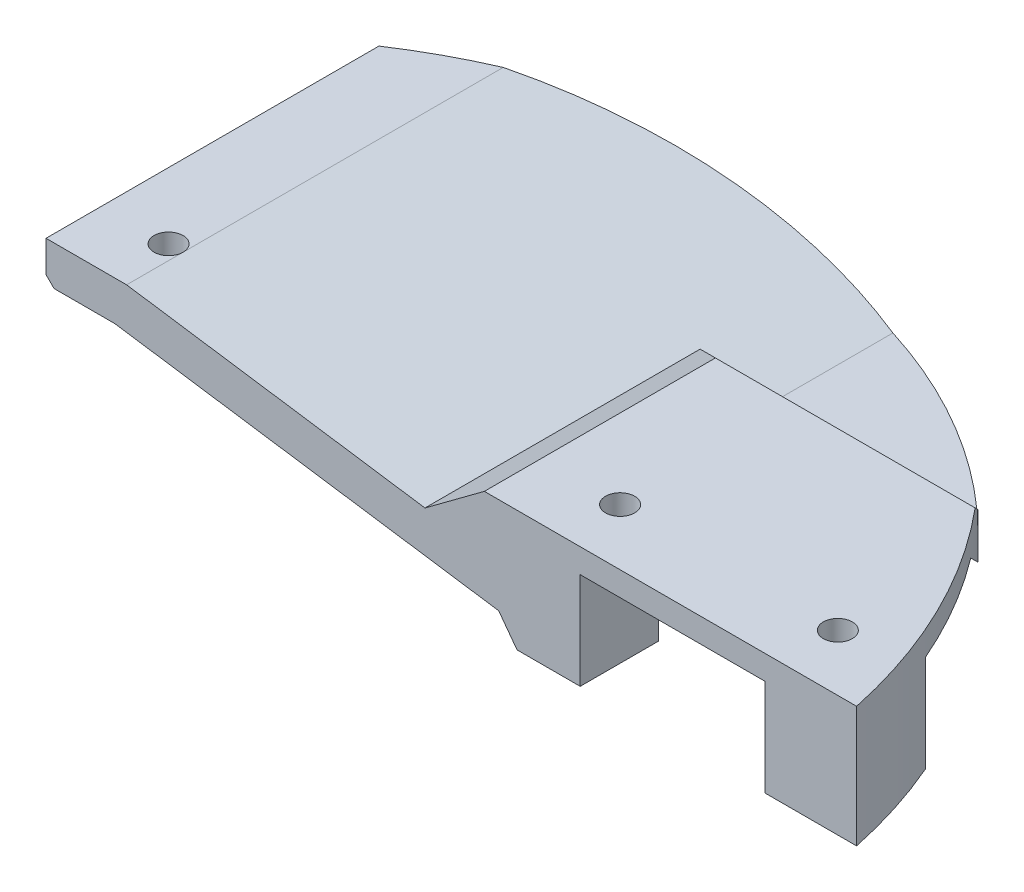
from build123d import *
from build123d.topology import SkipClean

# Parameters (mm, degrees)
SKETCH1_W            = 10
SKETCH1_H            = 10
BOSS_EXTRUDE1_DEPTH  = 4.9
CHAMFER1_SIZE        = 1
BOSS_EXTRUDE2_DEPTH  = 16
BOSS_EXTRUDE3_DEPTH  = 10
BOSS_EXTRUDE4_DEPTH  = 13
CHAMFER2_SIZE        = 12
BOSS_EXTRUDE5_DEPTH  = 30
CUT_EXTRUDE2_REACH   = 128.798
CUT_EXTRUDE1_START   = -15
CUT_EXTRUDE1_DEPTH   = 15
M3_CLEARANCE_HOLE1_D = 3.6
SKETCH11_W           = 1.8
SKETCH11_H           = 4.9
CHAMFER3_SIZE        = 9
CHAMFER3_SIZE_2      = 7.926193673
SKETCH14_R           = 1.8
BOSS_EXTRUDE6_DEPTH  = 12
M3_CLEARANCE_HOLE3_D = 3.6
SKETCH19_W           = 25
SKETCH19_H           = 20
CUT_EXTRUDE3_DEPTH   = 3.062116


# Read off the part's stored shape, not the designer's step: Cut-Extrude1
# Some blends are built 0.0001 mm under size
with BuildPart() as part:
    # Sketch1 → Boss-Extrude1 (new body)
    with BuildSketch(Plane(origin=(0, 0, 0), x_dir=(1, 0, 0), z_dir=(0, 1, 0))):
        with Locations((-5, 5)):
            Rectangle(SKETCH1_W, SKETCH1_H)
    extrude(amount=BOSS_EXTRUDE1_DEPTH)

    # Chamfer1
    chamfer1_edges = [part.edges().sort_by_distance(p)[0] for p in [
        (-10, 0, -5),
    ]]
    chamfer(chamfer1_edges, length=CHAMFER1_SIZE)

    # Sketch2 → Boss-Extrude2 (add)
    with BuildSketch(Plane(origin=(0, 0, -10), x_dir=(-1, 0, 0), z_dir=(0, 0, -1))):
        Polygon((-49.9, -10.1), (-48.419662682, -10.1), (-46.146212445, -7.037883957), (1.467233005, 0), (9, 0), (10, 1), (10, 4.9), (0, 4.9), (-45.9, -1.884614526), (-45.9, 4.9), (-95.9, 4.9), (-95.9, 1.9), (-49.9, 1.9), align=None)
    extrude(amount=BOSS_EXTRUDE2_DEPTH)

    # Sketch2<4> → Boss-Extrude3 (add)
    with BuildSketch(Plane(origin=(0, 0, -10), x_dir=(-1, 0, 0), z_dir=(0, 0, -1))):
        Polygon((-49.9, -10.1), (-48.419662682, -10.1), (-46.146212445, -7.037883957), (1.467233005, 0), (0, 0), (0, 4.9), (-45.9, -1.884614526), (-45.9, 4.9), (-95.9, 4.9), (-95.9, 1.9), (-49.9, 1.9), align=None)
    extrude(amount=-BOSS_EXTRUDE3_DEPTH)

    # Sketch3 → Boss-Extrude4 (add)
    with BuildSketch(Plane(origin=(0, 0, -26), x_dir=(-1, 0, 0), z_dir=(0, 0, -1))):
        Polygon((-95.9, 1.9), (-95.9, -10.1), (-49.9, -10.1), (-48.419662682, -10.1), (-46.146212445, -7.037883957), (1.467233005, 0), (9, 0), (10, 1), (10, 4.9), (0, 4.9), (-45.9, -1.884614526), (-45.9, 4.9), (-95.9, 4.9), align=None)
    extrude(amount=BOSS_EXTRUDE4_DEPTH)

    # Chamfer2
    chamfer2_edges = [part.edges().sort_by_distance(p)[0] for p in [
        (72.9, -10.1, -26),
    ]]
    chamfer(chamfer2_edges, length=CHAMFER2_SIZE - 0.0001)  # a hair under: the kernel refuses the full size

    # Sketch4 → Boss-Extrude5 (add)
    with BuildSketch(Plane(origin=(0, 0, -39), x_dir=(-1, 0, 0), z_dir=(0, 0, -1))):
        Polygon((-95.9, 4.9), (-95.9, -10.1), (-48.419662682, -10.1), (-46.146212445, -7.037883957), (1.467233005, 0), (9, 0), (10, 1), (10, 4.9), (0, 4.9), (-45.9, -1.884614526), (-45.9, 4.9), align=None)
    extrude(amount=BOSS_EXTRUDE5_DEPTH)

    # Sketch15 → Cut-Extrude2 (cut, up to next)
    with BuildSketch(Plane(origin=(95.9, 0, 0), x_dir=(0, 0, -1), z_dir=(1, 0, 0)), mode=Mode.PRIVATE) as cut_extrude2_sk1:
        Polygon((69, -1.884614526), (35.441468776, -1.884614526), (28.656854249, 4.9), (69, 4.9), align=None)
    cut_extrude2_tool1 = extrude(cut_extrude2_sk1.sketch, amount=-CUT_EXTRUDE2_REACH, mode=Mode.PRIVATE) & part.part
    add(cut_extrude2_tool1.solids().sort_by_distance((95.9, 1.611504, -50.472675))[0], mode=Mode.SUBTRACT)

    # Cut-Extrude1 outline → Cut-Extrude1 (cut)
    with BuildSketch(Plane(origin=(0, 4.9, 0), x_dir=(1, 0, 0), z_dir=(0, 1, 0)).offset(CUT_EXTRUDE1_START)):
        with BuildLine():
            ThreePointArc((-10, 41.287361933), (51.179168383, 47.220256879), (90.528084846, 0))
            Line((90.528084846, 0), (95.9, 0))
            Line((95.9, 0), (95.9, 69))
            Line((95.9, 69), (-10, 69))
            Line((-10, 69), (-10, 41.287361933))
        make_face()
    extrude(amount=CUT_EXTRUDE1_DEPTH, mode=Mode.SUBTRACT)

    # M3 Clearance Hole1 (through all)
    with Locations(Plane(origin=(0, 1.9, 0), x_dir=(-1, 0, 0), z_dir=(0, -1, 0))):
        with Locations((-81.2, 7), (-54.2, 7)):
            Hole(M3_CLEARANCE_HOLE1_D / 2)

    # Sketch11 → M3 Clearance Hole2 (revolve, cut)
    with BuildSketch(Plane(origin=(-1.8, 0, -7), x_dir=(0, 0, -1), z_dir=(1, 0, 0))):
        with Locations((0.9, 2.45)):
            Rectangle(SKETCH11_W, SKETCH11_H)
    revolve(axis=Axis((-1.8, -6.35, -7), (0, 1, 0)), mode=Mode.SUBTRACT)

    # Chamfer3
    # the kernel refuses this chamfer: 9, 7.926193673 mm, written as the material it adds along each edge
    with BuildSketch(Plane(origin=(45.9, -1.884614526, -35.441468776), x_dir=(-0.9928980217571691, 0.11896856051369163, 0), z_dir=(0, 0, 1))) as chamfer3_piece_1_section:
        Polygon((CHAMFER3_SIZE * 0.999621916911, -CHAMFER3_SIZE * 0.0274958766106), (CHAMFER3_SIZE_2 * 0.118968560518, -CHAMFER3_SIZE_2 * 0.992898021792), (0, 0), align=None)
    chamfer3_piece_1 = extrude(amount=35.441468776, mode=Mode.PRIVATE)
    chamfer3_piece_1 = split(chamfer3_piece_1, bisect_by=Plane(origin=(42.836377778, 4.9, -16.273200987), z_dir=(0, -1, 0)), keep=Keep.TOP, mode=Mode.PRIVATE)
    chamfer3_piece_1 = split(chamfer3_piece_1, bisect_by=Plane(origin=(42.836377778, 9.147052769, -24.40980148), z_dir=(6.542051911182403e-15, -0.7071067811865479, 0.7071067811865472)), keep=Keep.TOP, mode=Mode.PRIVATE)
    add(chamfer3_piece_1)

    # Sketch12 → Cut-Revolve1 (revolve, cut)
    with BuildSketch(Plane.XY.offset(-25)):
        Polygon((0, -0.5), (22, -0.5), (92, -7.331568331), (90.828874, -19.331568331), (0, -10.467230343), align=None)
    revolve(axis=Axis((90.828874, -19.331568331, -25), (-0.9952714730097288, 0.09713235821828223, 0)), mode=Mode.SUBTRACT)

    # Sketch14 → Boss-Extrude6 (add)
    # profile 1 of 2: a face of its own
    with SkipClean():  # the faces are left unmerged after this step: merging them gives an invalid solid
        with BuildSketch(Plane.XZ.offset(-1.9)):
            with BuildLine():
                Line((83.95, -12.5), (86.547763007, -12.5))
                ThreePointArc((86.547763007, -12.5), (88.850452987, -6.3495173), (90.528084846, 0))
                Line((90.528084846, 0), (79.15, 0))
                Line((79.15, 0), (79.15, -9.7))
                Line((79.15, -9.7), (83.95, -9.7))
                Line((83.95, -9.7), (83.95, -12.5))
            make_face()
            with Locations(Location((81.2, -7, 0), (0, 0, 270))):
                Circle(SKETCH14_R, mode=Mode.SUBTRACT)
        # profile 2 of 2: a face of its own
        with BuildSketch(Plane.XZ.offset(-1.9)):
            Polygon((49.9, 0), (49.9, -12.5), (51.45, -12.5), (51.45, -9.7), (56.25, -9.7), (56.25, 0), align=None)
            with Locations(Location((54.2, -7, 0), (0, 0, 270))):
                Circle(SKETCH14_R, mode=Mode.SUBTRACT)
        extrude(amount=BOSS_EXTRUDE6_DEPTH)
    add(part.part.scale(1), mode=Mode.REPLACE)  # the faces are merged on a copy

    # M3 Clearance Hole3 (through all)
    with Locations(Plane(origin=(0, 4.9, 0), x_dir=(1, 0, 0), z_dir=(0, 1, 0))):
        with Locations((-1.8, 7)):
            Hole(M3_CLEARANCE_HOLE3_D / 2)

    # Sketch19 → Cut-Extrude3 (cut)
    with BuildSketch(Plane.XZ.offset(10.1)):
        with Locations((58.646212445, -40)):
            Rectangle(SKETCH19_W, SKETCH19_H)
    extrude(amount=-CUT_EXTRUDE3_DEPTH, mode=Mode.SUBTRACT)


solid = part.part
